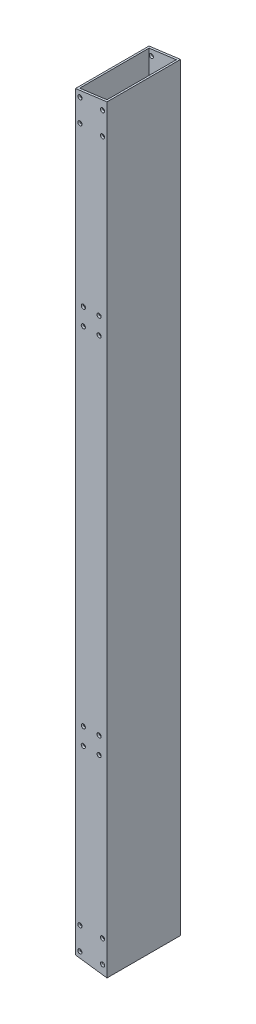
from build123d import *

# Parameters (mm, degrees)
SKETCH_1_W          = 30
SKETCH_1_H          = 750
SKETCH_1_R          = 2
EXTRUDE_2_DEPTH     = 70
SKETCH_2_W          = 26
SKETCH_2_H          = 66
CUT_EXTRUDE_3_DEPTH = 754.408919512
CUT_EXTRUDE_4_DEPTH = 382.772183376
SKETCH_8_R          = 2
CUT_EXTRUDE_6_DEPTH = 382.772183376


with BuildPart() as part:
    # 草图1 → 凸台-拉伸2 (new body)
    with BuildSketch(Plane.XY):
        Rectangle(SKETCH_1_W, SKETCH_1_H)
        with Locations((-7.5, 194.978117754)):
            Circle(SKETCH_1_R, mode=Mode.SUBTRACT)
        with Locations((7.5, 194.978117754)):
            Circle(SKETCH_1_R, mode=Mode.SUBTRACT)
        with Locations((-7.5, 178.773554479)):
            Circle(SKETCH_1_R, mode=Mode.SUBTRACT)
        with Locations((7.5, 178.773554479)):
            Circle(SKETCH_1_R, mode=Mode.SUBTRACT)
        with Locations((-7.5, -150.877478615)):
            Circle(SKETCH_1_R, mode=Mode.SUBTRACT)
        with Locations((7.5, -150.877478615)):
            Circle(SKETCH_1_R, mode=Mode.SUBTRACT)
        with Locations((-7.5, -167.08204189)):
            Circle(SKETCH_1_R, mode=Mode.SUBTRACT)
        with Locations((7.5, -167.08204189)):
            Circle(SKETCH_1_R, mode=Mode.SUBTRACT)
    extrude(amount=EXTRUDE_2_DEPTH)

    # 草图2 → 切除-拉伸3 (cut, through all)
    with BuildSketch(Plane.XZ.offset(375)):
        with Locations((0, 35)):
            Rectangle(SKETCH_2_W, SKETCH_2_H)
    extrude(amount=-CUT_EXTRUDE_3_DEPTH, mode=Mode.SUBTRACT)

    # 草图3 → 切除-拉伸4 (cut, through all)
    with BuildSketch(Plane.XY.offset(70)):
        Polygon((-15, 371.050425072), (15, 375), (15, 377.040830045), (-15, 377.040830045), align=None)
        Polygon((15, -375), (15, -347.1), (-15, -343.150425072), (-15, -375), align=None)
    extrude(amount=-CUT_EXTRUDE_4_DEPTH, mode=Mode.SUBTRACT)

    # 草图8 → 切除-拉伸6 (cut, through all)
    with BuildSketch(Plane(origin=(0, 0, 0), x_dir=(-1, 0, 0), z_dir=(0, 0, -1))):
        with Locations((-10.752728605, -316.565073143)):
            Circle(SKETCH_8_R)
        with Locations((10.752728605, -338.070530352)):
            Circle(SKETCH_8_R)
        with Locations((10.752728605, -316.565073143)):
            Circle(SKETCH_8_R)
        with Locations((-10.752728605, -338.070530352)):
            Circle(SKETCH_8_R)
        with Locations((-10.752728605, 365.970530352)):
            Circle(SKETCH_8_R)
        with Locations((-10.752728605, 344.465073143)):
            Circle(SKETCH_8_R)
        with Locations((10.752728605, 344.465073143)):
            Circle(SKETCH_8_R)
        with Locations((10.752728605, 365.970530352)):
            Circle(SKETCH_8_R)
    extrude(amount=-CUT_EXTRUDE_6_DEPTH, mode=Mode.SUBTRACT)


solid = part.part
